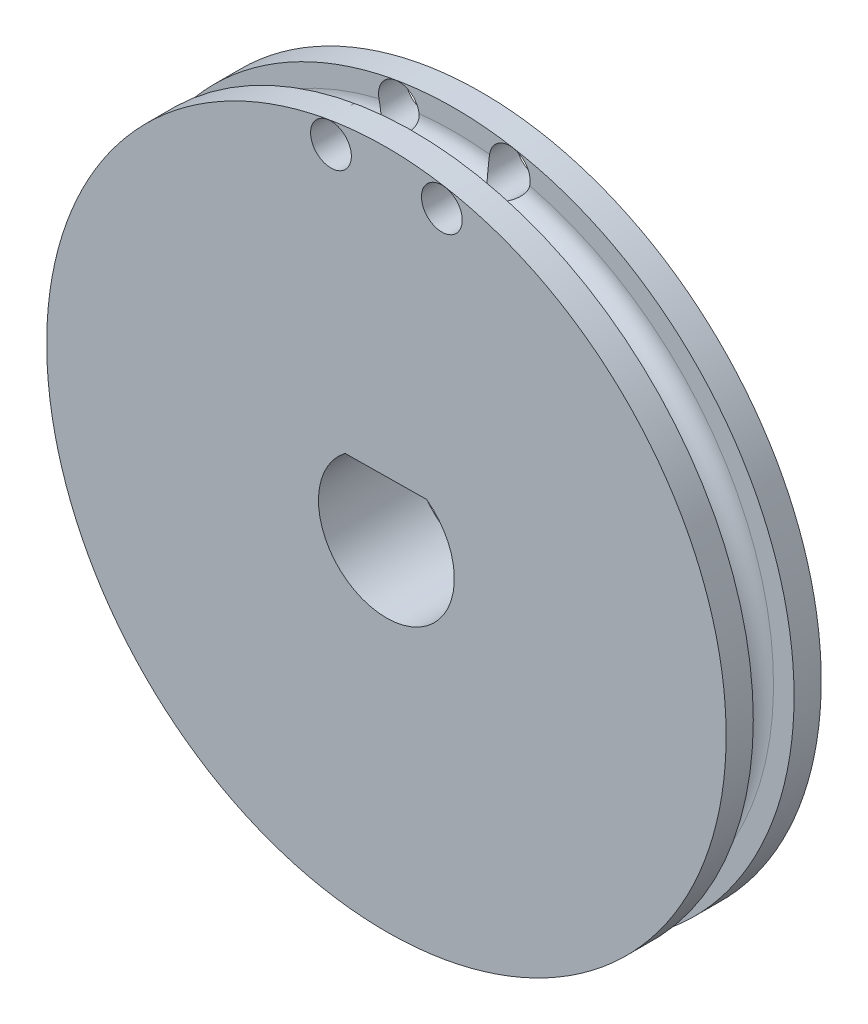
from build123d import *
from OCP.BRepAlgoAPI import BRepAlgoAPI_Cut
from OCP.TopTools import TopTools_ListOfShape

# Parameters (mm, degrees)
CUT_EXTRUDE1_DEPTH  = 9
SKETCH4_R           = 1.5
CUT_EXTRUDE10_DEPTH = 33.49


with BuildPart() as part:
    # Sketch2 → Revolve1 (revolve)
    with BuildSketch(Plane(origin=(0, 0, 0), x_dir=(0, 0, -1), z_dir=(1, 0, 0))):
        with BuildLine():
            Line((-3.572036915, 0), (3.427963085, 0))
            Line((3.427963085, 0), (3.427963085, 25))
            Line((3.427963085, 25), (1.427963085, 25))
            Line((1.427963085, 25), (1.427963085, 23.49))
            ThreePointArc((1.427963085, 23.49), (-0.072036915, 21.99), (-1.572036915, 23.49))
            Line((-1.572036915, 23.49), (-1.572036915, 25))
            Line((-1.572036915, 25), (-3.572036915, 25))
            Line((-3.572036915, 25), (-3.572036915, 0))
        make_face()
    revolve(axis=Axis((0, 0, 3.572036915), (0, 0, -1)))

    # Sketch3 → Cut-Extrude1 (cut)
    with BuildSketch(Plane(origin=(0, 0, -3.427963085), x_dir=(-1, 0, 0), z_dir=(0, 0, -1))):
        with BuildLine():
            Line((-2.95661762, 4.03217215), (3.043032331, 3.967361117))
            ThreePointArc((3.043032331, 3.967361117), (-0.054009195, -4.999708292), (-2.95661762, 4.03217215))
        make_face()
    extrude(amount=-CUT_EXTRUDE1_DEPTH, mode=Mode.SUBTRACT)


with BuildPart() as cut_extrude10_tool:
    # Sketch4 → Cut-Extrude10 (new body)
    with BuildSketch(Plane(origin=(0, 0, -3.427963085), x_dir=(-1, 0, 0), z_dir=(0, 0, -1))):
        with Locations((-4.078995693, 23.133134118)):
            Circle(SKETCH4_R)
        with Locations((4.078995693, 23.133134118)):
            Circle(SKETCH4_R)
    extrude(amount=-CUT_EXTRUDE10_DEPTH)


with BuildPart() as part_1:
    add(part.part)

    # Cut-Extrude10: cut by cut_extrude10_tool, with a tolerance
    cut_extrude10_stock = TopTools_ListOfShape()
    cut_extrude10_stock.Append(part_1.part.wrapped)
    cut_extrude10_tools = TopTools_ListOfShape()
    cut_extrude10_tools.Append(cut_extrude10_tool.part.wrapped)
    cut_extrude10_cut = BRepAlgoAPI_Cut()
    cut_extrude10_cut.SetArguments(cut_extrude10_stock)
    cut_extrude10_cut.SetTools(cut_extrude10_tools)
    cut_extrude10_cut.SetFuzzyValue(0.00001)
    cut_extrude10_cut.Build()
    add(Compound.cast(cut_extrude10_cut.Shape()).solids(), mode=Mode.REPLACE)


solid = part_1.part
